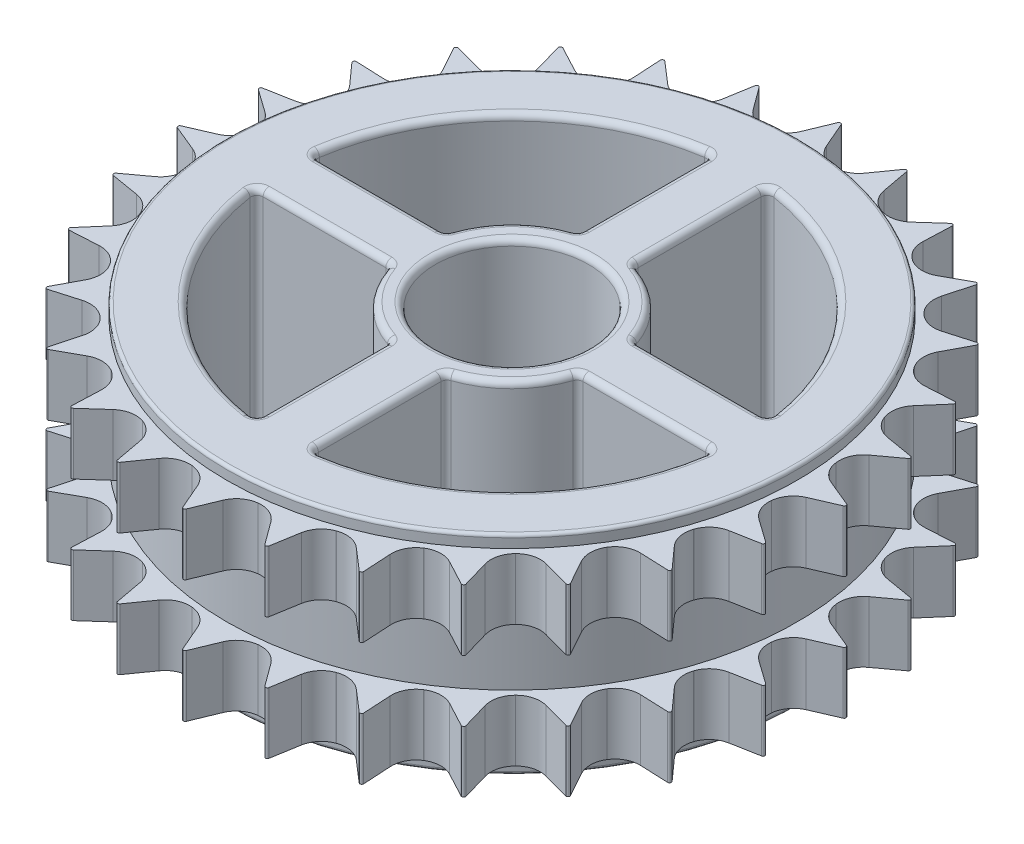
from build123d import *
from build123d.topology import SkipClean

# Parameters (mm, degrees)
BOSS_EXTRUDE2_START  = 2
SKETCH1_R            = 47.5
BOSS_EXTRUDE2_DEPTH  = 10
SKETCH1_7_R          = 46.5
SKETCH1_7_R_2        = 37.5
SKETCH1_7_R_3        = 16
SKETCH1_7_R_4        = 5
SKETCH1_7_R_5        = 2.2
BOSS_EXTRUDE3_DEPTH  = 22
BOSS_EXTRUDE4_START  = 22
SKETCH1_8_R          = 47.5
BOSS_EXTRUDE4_DEPTH  = 10
BOSS_EXTRUDE6_START  = 2
BOSS_EXTRUDE6_DEPTH  = 10
BOSS_EXTRUDE7_START  = 22
BOSS_EXTRUDE7_DEPTH  = 10
FILLET1_R            = 4
FILLET2_R            = 0.3
CIRPATTERN1_START    = 2
CIRPATTERN1_DEPTH    = 10
CIRPATTERN1_START_2  = 22
CIRPATTERN1_2_DEPTH  = 10
SKETCH6_R            = 46.5
SKETCH6_R_2          = 37.5
SKETCH6_R_3          = 16
BOSS_EXTRUDE12_DEPTH = 2
FILLET9_R            = 0.5
CUT_EXTRUDE1_REACH   = 85.63
SKETCH7_R            = 1.5
SKETCH10_R           = 12.5
CUT_EXTRUDE2_DEPTH   = 21
FILLET17_R           = 1


# Read off the part's stored shape, not the designer's step: CirPattern1
with BuildPart() as part:
    # Sketch1 → Boss-Extrude2 (new body)
    with BuildSketch(Plane(origin=(0, 0, 0), x_dir=(1, 0, 0), z_dir=(0, 1, 0)).offset(BOSS_EXTRUDE2_START)):
        with Locations(Location((0, 0, 0), (0, 0, 270))):
            Circle(SKETCH1_R)
        with BuildLine():
            ThreePointArc((-37.229020938, 4.5), (-26.516504294, 26.516504294), (-4.5, 37.229020938))
            Line((-4.5, 37.229020938), (-4.5, 15.354152533))
            ThreePointArc((-4.5, 15.354152533), (-11.313708499, 11.313708499), (-15.354152533, 4.5))
            Line((-15.354152533, 4.5), (-37.229020938, 4.5))
        make_face(mode=Mode.SUBTRACT)
        with BuildLine():
            ThreePointArc((-4.5, -37.229020938), (-26.516504294, -26.516504294), (-37.229020938, -4.5))
            Line((-37.229020938, -4.5), (-15.354152533, -4.5))
            ThreePointArc((-15.354152533, -4.5), (-11.313708499, -11.313708499), (-4.5, -15.354152533))
            Line((-4.5, -15.354152533), (-4.5, -37.229020938))
        make_face(mode=Mode.SUBTRACT)
        with BuildLine():
            ThreePointArc((37.229020938, -4.5), (26.516504294, -26.516504294), (4.5, -37.229020938))
            Line((4.5, -37.229020938), (4.5, -15.354152533))
            ThreePointArc((4.5, -15.354152533), (11.313708499, -11.313708499), (15.354152533, -4.5))
            Line((15.354152533, -4.5), (37.229020938, -4.5))
        make_face(mode=Mode.SUBTRACT)
        with BuildLine():
            ThreePointArc((4.5, 37.229020938), (26.516504294, 26.516504294), (37.229020938, 4.5))
            Line((37.229020938, 4.5), (15.354152533, 4.5))
            ThreePointArc((15.354152533, 4.5), (11.313708499, 11.313708499), (4.5, 15.354152533))
            Line((4.5, 15.354152533), (4.5, 37.229020938))
        make_face(mode=Mode.SUBTRACT)
    extrude(amount=BOSS_EXTRUDE2_DEPTH)

    # Sketch1<7> → Boss-Extrude3 (add)
    # profile 1 of 9: a face of its own
    with SkipClean():  # the faces are left unmerged after this step: merging them gives an invalid solid
        with BuildSketch(Plane(origin=(0, 0, 0), x_dir=(1, 0, 0), z_dir=(0, 1, 0))):
            with Locations(Location((0, 0, 0), (0, 0, 270))):
                Circle(SKETCH1_7_R)
            Circle(SKETCH1_7_R_2, mode=Mode.SUBTRACT)
        # profile 2 of 9: a face of its own
        with BuildSketch(Plane(origin=(0, 0, 0), x_dir=(1, 0, 0), z_dir=(0, 1, 0))):
            Circle(SKETCH1_7_R_3)
            Circle(SKETCH1_7_R_4, mode=Mode.SUBTRACT)
        # profile 3 of 9: a face of its own
        with BuildSketch(Plane(origin=(0, 0, 0), x_dir=(1, 0, 0), z_dir=(0, 1, 0))):
            Circle(SKETCH1_7_R_4)
            Circle(SKETCH1_7_R_5, mode=Mode.SUBTRACT)
        # profile 4 of 9: a face of its own
        with BuildSketch(Plane(origin=(0, 0, 0), x_dir=(1, 0, 0), z_dir=(0, 1, 0))):
            with BuildLine():
                Line((-1.7, -1.396424004), (-1.7, 1.396424004))
                ThreePointArc((-1.7, 1.396424004), (-2.2, 0), (-1.7, -1.396424004))
            make_face()
        # profile 5 of 9: a face of its own
        with BuildSketch(Plane(origin=(0, 0, 0), x_dir=(1, 0, 0), z_dir=(0, 1, 0))):
            with BuildLine():
                ThreePointArc((2.2, 0), (0.741619849, 2.071231518), (-1.7, 1.396424004))
                Line((-1.7, 1.396424004), (-1.7, -1.396424004))
                ThreePointArc((-1.7, -1.396424004), (0.741619849, -2.071231518), (2.2, 0))
            make_face()
        # profile 6 of 9: a face of its own
        with BuildSketch(Plane(origin=(0, 0, 0), x_dir=(1, 0, 0), z_dir=(0, 1, 0))):
            with BuildLine():
                Line((-15.354152533, 4.5), (-37.229020938, 4.5))
                ThreePointArc((-37.229020938, 4.5), (-37.5, 0), (-37.229020938, -4.5))
                Line((-37.229020938, -4.5), (-15.354152533, -4.5))
                ThreePointArc((-15.354152533, -4.5), (-16, 0), (-15.354152533, 4.5))
            make_face()
        # profile 7 of 9: a face of its own
        with BuildSketch(Plane(origin=(0, 0, 0), x_dir=(1, 0, 0), z_dir=(0, 1, 0))):
            with BuildLine():
                Line((-4.5, -15.354152533), (-4.5, -37.229020938))
                ThreePointArc((-4.5, -37.229020938), (0, -37.5), (4.5, -37.229020938))
                Line((4.5, -37.229020938), (4.5, -15.354152533))
                ThreePointArc((4.5, -15.354152533), (0, -16), (-4.5, -15.354152533))
            make_face()
        # profile 8 of 9: a face of its own
        with BuildSketch(Plane(origin=(0, 0, 0), x_dir=(1, 0, 0), z_dir=(0, 1, 0))):
            with BuildLine():
                ThreePointArc((37.5, 0), (37.432193932, 2.254075734), (37.229020938, 4.5))
                Line((37.229020938, 4.5), (15.354152533, 4.5))
                ThreePointArc((15.354152533, 4.5), (15.837715121, 2.273055155), (16, 0))
                ThreePointArc((16, 0), (15.837715121, -2.273055155), (15.354152533, -4.5))
                Line((15.354152533, -4.5), (37.229020938, -4.5))
                ThreePointArc((37.229020938, -4.5), (37.432193932, -2.254075734), (37.5, 0))
            make_face()
        # profile 9 of 9: a face of its own
        with BuildSketch(Plane(origin=(0, 0, 0), x_dir=(1, 0, 0), z_dir=(0, 1, 0))):
            with BuildLine():
                ThreePointArc((4.5, 37.229020938), (0, 37.5), (-4.5, 37.229020938))
                Line((-4.5, 37.229020938), (-4.5, 15.354152533))
                ThreePointArc((-4.5, 15.354152533), (0, 16), (4.5, 15.354152533))
                Line((4.5, 15.354152533), (4.5, 37.229020938))
            make_face()
        extrude(amount=BOSS_EXTRUDE3_DEPTH)
    add(part.part.scale(1), mode=Mode.REPLACE)  # the faces are merged on a copy

    # Sketch1<8> → Boss-Extrude4 (add)
    with BuildSketch(Plane(origin=(0, 0, 0), x_dir=(1, 0, 0), z_dir=(0, 1, 0)).offset(BOSS_EXTRUDE4_START)):
        with Locations(Location((0, 0, 0), (0, 0, 270))):
            Circle(SKETCH1_8_R)
        with BuildLine():
            ThreePointArc((-37.229020938, 4.5), (-26.516504294, 26.516504294), (-4.5, 37.229020938))
            Line((-4.5, 37.229020938), (-4.5, 15.354152533))
            ThreePointArc((-4.5, 15.354152533), (-11.313708499, 11.313708499), (-15.354152533, 4.5))
            Line((-15.354152533, 4.5), (-37.229020938, 4.5))
        make_face(mode=Mode.SUBTRACT)
        with BuildLine():
            ThreePointArc((-4.5, -37.229020938), (-26.516504294, -26.516504294), (-37.229020938, -4.5))
            Line((-37.229020938, -4.5), (-15.354152533, -4.5))
            ThreePointArc((-15.354152533, -4.5), (-11.313708499, -11.313708499), (-4.5, -15.354152533))
            Line((-4.5, -15.354152533), (-4.5, -37.229020938))
        make_face(mode=Mode.SUBTRACT)
        with BuildLine():
            ThreePointArc((37.229020938, -4.5), (26.516504294, -26.516504294), (4.5, -37.229020938))
            Line((4.5, -37.229020938), (4.5, -15.354152533))
            ThreePointArc((4.5, -15.354152533), (11.313708499, -11.313708499), (15.354152533, -4.5))
            Line((15.354152533, -4.5), (37.229020938, -4.5))
        make_face(mode=Mode.SUBTRACT)
        with BuildLine():
            ThreePointArc((4.5, 37.229020938), (26.516504294, 26.516504294), (37.229020938, 4.5))
            Line((37.229020938, 4.5), (15.354152533, 4.5))
            ThreePointArc((15.354152533, 4.5), (11.313708499, 11.313708499), (4.5, 15.354152533))
            Line((4.5, 15.354152533), (4.5, 37.229020938))
        make_face(mode=Mode.SUBTRACT)
        with BuildLine():
            Line((-1.7, -1.396424004), (-1.7, 1.396424004))
            ThreePointArc((-1.7, 1.396424004), (2.2, 0), (-1.7, -1.396424004))
        make_face(mode=Mode.SUBTRACT)
    extrude(amount=BOSS_EXTRUDE4_DEPTH)

    # Sketch1<10> → Boss-Extrude6 (add)
    with BuildSketch(Plane(origin=(0, 0, 0), x_dir=(1, 0, 0), z_dir=(0, 1, 0)).offset(BOSS_EXTRUDE6_START)):
        with BuildLine():
            ThreePointArc((-13.851518822, 45.43550843), (-10.95425386, 46.219631353), (-8.013249598, 46.819203655))
            Line((-8.013249598, 46.819203655), (-12.568564955, 53.030945447))
            Line((-12.568564955, 53.030945447), (-13.851518822, 45.43550843))
        make_face()
    extrude(amount=BOSS_EXTRUDE6_DEPTH)

    # Sketch1<12> → Boss-Extrude7 (add)
    with BuildSketch(Plane(origin=(0, 0, 0), x_dir=(1, 0, 0), z_dir=(0, 1, 0)).offset(BOSS_EXTRUDE7_START)):
        with BuildLine():
            ThreePointArc((-13.851518822, 45.43550843), (-10.95425386, 46.219631353), (-8.013249598, 46.819203655))
            Line((-8.013249598, 46.819203655), (-12.568564955, 53.030945447))
            Line((-12.568564955, 53.030945447), (-13.851518822, 45.43550843))
        make_face()
    extrude(amount=BOSS_EXTRUDE7_DEPTH)

    # Fillet1
    # the kernel refuses this fillet: 4 mm, written as the material it adds along each edge
    with BuildSketch(Plane(origin=(-13.851518822, 2, -45.43550843), x_dir=(-0.9491637939504916, 0, 0.31478261110409), z_dir=(0, 1, 0)), Plane(origin=(-13.851518822, 22, -45.43550843), x_dir=(-0.9491637939504916, 0, 0.31478261110409), z_dir=(0, 1, 0))) as fillet1_piece_1:
        with BuildLine():
            CenterArc((2.407154411, -3.998817417), FILLET1_R, 91.393266483, 60.671643531)
            Line((-1.126761138, -2.124933512), (0, 0))
            ThreePointArc((0, 0), (1.154947824, -0.014043176), (2.309895647, 0))
        make_face()
    extrude(amount=10)
    with BuildSketch(Plane(origin=(-8.013249598, 2, -46.819203655), x_dir=(0.9894779250922444, 0, -0.1446839167120761), z_dir=(0, 1, 0)), Plane(origin=(-8.013249598, 22, -46.819203655), x_dir=(0.9894779250922444, 0, -0.1446839167120761), z_dir=(0, 1, 0))) as fillet1_piece_2:
        with BuildLine():
            CenterArc((2.407154411, 3.998817417), FILLET1_R, 207.935089986, 60.671643531)
            Line((-1.126761138, 2.124933512), (0, 0))
            ThreePointArc((0, 0), (1.154947824, 0.014043176), (2.309895647, 0))
        make_face()
    extrude(amount=10)

    # Fillet2
    fillet2_edges = [part.edges().sort_by_distance(p)[0] for p in [
        (-12.568564955, 7, -53.030945447),
        (-12.568564955, 27, -53.030945447),
    ]]
    fillet(fillet2_edges, radius=FILLET2_R)

    # CirPattern1 outline → CirPattern1 (add)
    with BuildSketch(Plane(origin=(0, 0, 0), x_dir=(1, 0, 0), z_dir=(0, 1, 0)).offset(CIRPATTERN1_START)):
        with BuildLine():
            ThreePointArc((-5.693178393, 47.157583905), (-0.39477231, 47.498359496), (4.908565997, 47.245698003))
            ThreePointArc((4.908565997, 47.245698003), (2.955708963, 47.999217142), (1.650815114, 49.635888682))
            Line((1.650815114, 49.635888682), (-0.171214513, 53.846971164))
            ThreePointArc((-0.171214513, 53.846971164), (-0.449040598, 54.027831221), (-0.723822151, 53.842378285))
            Line((-0.723822151, 53.842378285), (-2.475605911, 49.601592829))
            ThreePointArc((-2.475605911, 49.601592829), (-3.753115694, 47.943458201), (-5.693178393, 47.157583905))
        make_face()
        with BuildLine():
            ThreePointArc((4.943111089, 47.242096193), (10.184504772, 46.395321558), (15.298654844, 44.968891024))
            ThreePointArc((15.298654844, 44.968891024), (13.562433796, 46.138069436), (12.65445004, 48.024072401))
            Line((12.65445004, 48.024072401), (11.815156506, 52.535013987))
            ThreePointArc((11.815156506, 52.535013987), (11.584541251, 52.773161625), (11.275381884, 52.653503029))
            Line((11.275381884, 52.653503029), (8.623855459, 48.908851477))
            ThreePointArc((8.623855459, 48.908851477), (7.009405849, 47.576562416), (4.943111089, 47.242096193))
        make_face()
        with BuildLine():
            ThreePointArc((15.331532341, 44.957692512), (20.253088259, 42.965828468), (24.921605256, 40.437156075))
            ThreePointArc((24.921605256, 40.437156075), (23.489081567, 41.963366272), (23.023538, 44.004128599))
            Line((23.023538, 44.004128599), (23.209066243, 48.588731842))
            ThreePointArc((23.209066243, 48.588731842), (23.037225828, 48.872225344), (22.709191189, 48.82436127))
            Line((22.709191189, 48.82436127), (19.290880707, 45.763616086))
            ThreePointArc((19.290880707, 45.763616086), (17.420446513, 44.823979129), (15.331532341, 44.957692512))
        make_face()
        with BuildLine():
            ThreePointArc((24.951166542, 40.418922402), (29.30609733, 37.381849329), (33.294882316, 33.877733269))
            ThreePointArc((33.294882316, 33.877733269), (32.237888706, 35.6844447), (32.238129627, 37.777634043))
            Line((32.238129627, 37.777634043), (33.439176485, 42.206007794))
            ThreePointArc((33.439176485, 42.206007794), (33.334727707, 42.520631611), (33.004266823, 42.546962164))
            Line((33.004266823, 42.546962164), (28.990580645, 40.323601893))
            ThreePointArc((28.990580645, 40.323601893), (26.957953248, 39.82373436), (24.951166542, 40.418922402))
        make_face()
        with BuildLine():
            ThreePointArc((33.319645066, 33.853378748), (36.88957631, 29.923388171), (39.998614951, 25.619539457))
            ThreePointArc((39.998614951, 25.619539457), (39.370153491, 27.616156065), (39.83616682, 29.656811171))
            Line((39.83616682, 29.656811171), (41.992506788, 33.706898278))
            ThreePointArc((41.992506788, 33.706898278), (41.960687145, 34.036875859), (41.644370705, 34.136080714))
            Line((41.644370705, 34.136080714), (37.236571815, 32.861593924))
            ThreePointArc((37.236571815, 32.861593924), (35.14367564, 32.826561261), (33.319645066, 33.853378748))
        make_face()
        with BuildLine():
            ThreePointArc((40.017337455, 25.590285323), (42.623257896, 20.964443381), (44.696650011, 16.076674958))
            ThreePointArc((44.696650011, 16.076674958), (44.528234385, 18.16307805), (45.436652267, 20.048871951))
            Line((45.436652267, 20.048871951), (48.440157456, 23.517584135))
            ThreePointArc((48.440157456, 23.517584135), (48.482562517, 23.846369026), (48.196251947, 24.013473637))
            Line((48.196251947, 24.013473637), (43.615365788, 23.751768418))
            ThreePointArc((43.615365788, 23.751768418), (41.567147389, 24.183327308), (40.017337455, 25.590285323))
        make_face()
        with BuildLine():
            ThreePointArc((44.708393447, 16.043988138), (46.219631352, 10.95425386), (47.153408404, 5.727658846))
            ThreePointArc((47.153408404, 5.727658846), (47.453483674, 7.799227459), (48.758754243, 9.435598575))
            Line((48.758754243, 9.435598575), (52.45881636, 12.149000122))
            ThreePointArc((52.45881636, 12.149000122), (52.573319759, 12.460105675), (52.331371867, 12.686730721))
            Line((52.331371867, 12.686730721), (47.807103198, 13.450930064))
            ThreePointArc((47.807103198, 13.450930064), (45.906268798, 14.327440343), (44.708393447, 16.043988138))
        make_face()
        with BuildLine():
            ThreePointArc((47.157583905, 5.693178393), (47.498359496, 0.39477231), (47.245698003, -4.908565997))
            ThreePointArc((47.245698003, -4.908565997), (47.999217142, -2.955708963), (49.635888682, -1.650815114))
            Line((49.635888682, -1.650815114), (53.846971164, 0.171214513))
            ThreePointArc((53.846971164, 0.171214513), (54.027831221, 0.449040598), (53.842378285, 0.723822151))
            Line((53.842378285, 0.723822151), (49.601592829, 2.475605911))
            ThreePointArc((49.601592829, 2.475605911), (47.943458201, 3.753115694), (47.157583905, 5.693178393))
        make_face()
        with BuildLine():
            ThreePointArc((47.242096193, -4.943111089), (46.395321558, -10.184504772), (44.968891024, -15.298654844))
            ThreePointArc((44.968891024, -15.298654844), (46.138069436, -13.562433796), (48.024072401, -12.65445004))
            Line((48.024072401, -12.65445004), (52.535013987, -11.815156506))
            ThreePointArc((52.535013987, -11.815156506), (52.773161625, -11.584541251), (52.653503029, -11.275381884))
            Line((52.653503029, -11.275381884), (48.908851477, -8.623855459))
            ThreePointArc((48.908851477, -8.623855459), (47.576562416, -7.009405849), (47.242096193, -4.943111089))
        make_face()
        with BuildLine():
            ThreePointArc((44.957692513, -15.331532341), (42.965828468, -20.253088259), (40.437156075, -24.921605256))
            ThreePointArc((40.437156075, -24.921605256), (41.963366272, -23.489081567), (44.004128599, -23.023538))
            Line((44.004128599, -23.023538), (48.588731842, -23.209066243))
            ThreePointArc((48.588731842, -23.209066243), (48.872225344, -23.037225828), (48.82436127, -22.709191189))
            Line((48.82436127, -22.709191189), (45.763616086, -19.290880707))
            ThreePointArc((45.763616086, -19.290880707), (44.823979129, -17.420446513), (44.957692513, -15.331532341))
        make_face()
        with BuildLine():
            ThreePointArc((40.418922402, -24.951166542), (37.381849329, -29.30609733), (33.87773327, -33.294882317))
            ThreePointArc((33.87773327, -33.294882317), (35.6844447, -32.237888706), (37.777634043, -32.238129627))
            Line((37.777634043, -32.238129627), (42.206007794, -33.439176485))
            ThreePointArc((42.206007794, -33.439176485), (42.520631611, -33.334727707), (42.546962164, -33.004266823))
            Line((42.546962164, -33.004266823), (40.323601893, -28.990580645))
            ThreePointArc((40.323601893, -28.990580645), (39.82373436, -26.957953248), (40.418922402, -24.951166542))
        make_face()
        with BuildLine():
            ThreePointArc((33.853378748, -33.319645066), (29.923388171, -36.88957631), (25.619539457, -39.998614951))
            ThreePointArc((25.619539457, -39.998614951), (27.616156065, -39.370153491), (29.656811171, -39.83616682))
            Line((29.656811171, -39.83616682), (33.706898278, -41.992506788))
            ThreePointArc((33.706898278, -41.992506788), (34.036875859, -41.960687145), (34.136080714, -41.644370705))
            Line((34.136080714, -41.644370705), (32.861593924, -37.236571815))
            ThreePointArc((32.861593924, -37.236571815), (32.826561261, -35.14367564), (33.853378748, -33.319645066))
        make_face()
        with BuildLine():
            ThreePointArc((25.590285324, -40.017337456), (20.964443381, -42.623257897), (16.076674958, -44.696650012))
            ThreePointArc((16.076674958, -44.696650012), (18.16307805, -44.528234385), (20.048871951, -45.436652267))
            Line((20.048871951, -45.436652267), (23.517584135, -48.440157456))
            ThreePointArc((23.517584135, -48.440157456), (23.846369026, -48.482562517), (24.013473637, -48.196251947))
            Line((24.013473637, -48.196251947), (23.751768418, -43.615365788))
            ThreePointArc((23.751768418, -43.615365788), (24.183327308, -41.567147389), (25.590285324, -40.017337456))
        make_face()
        with BuildLine():
            ThreePointArc((16.043988138, -44.708393447), (10.95425386, -46.219631353), (5.727658846, -47.153408405))
            ThreePointArc((5.727658846, -47.153408405), (7.799227459, -47.453483674), (9.435598575, -48.758754243))
            Line((9.435598575, -48.758754243), (12.149000122, -52.45881636))
            ThreePointArc((12.149000122, -52.45881636), (12.460105675, -52.573319759), (12.686730721, -52.331371867))
            Line((12.686730721, -52.331371867), (13.450930064, -47.807103198))
            ThreePointArc((13.450930064, -47.807103198), (14.327440343, -45.906268798), (16.043988138, -44.708393447))
        make_face()
        with BuildLine():
            ThreePointArc((5.693178393, -47.157583906), (0.39477231, -47.498359497), (-4.908565997, -47.245698004))
            ThreePointArc((-4.908565997, -47.245698004), (-2.955708963, -47.999217142), (-1.650815114, -49.635888682))
            Line((-1.650815114, -49.635888682), (0.171214513, -53.846971164))
            ThreePointArc((0.171214513, -53.846971164), (0.449040598, -54.027831221), (0.723822151, -53.842378285))
            Line((0.723822151, -53.842378285), (2.475605911, -49.601592829))
            ThreePointArc((2.475605911, -49.601592829), (3.753115694, -47.943458201), (5.693178393, -47.157583906))
        make_face()
        with BuildLine():
            ThreePointArc((-4.943111089, -47.242096194), (-10.184504772, -46.395321559), (-15.298654844, -44.968891025))
            ThreePointArc((-15.298654844, -44.968891025), (-13.562433796, -46.138069436), (-12.65445004, -48.024072401))
            Line((-12.65445004, -48.024072401), (-11.815156506, -52.535013987))
            ThreePointArc((-11.815156506, -52.535013987), (-11.584541251, -52.773161625), (-11.275381884, -52.653503029))
            Line((-11.275381884, -52.653503029), (-8.623855459, -48.908851477))
            ThreePointArc((-8.623855459, -48.908851477), (-7.009405849, -47.576562416), (-4.943111089, -47.242096194))
        make_face()
        with BuildLine():
            ThreePointArc((-15.331532341, -44.957692513), (-20.253088259, -42.965828469), (-24.921605257, -40.437156076))
            ThreePointArc((-24.921605257, -40.437156076), (-23.489081567, -41.963366272), (-23.023538, -44.004128599))
            Line((-23.023538, -44.004128599), (-23.209066243, -48.588731842))
            ThreePointArc((-23.209066243, -48.588731842), (-23.037225828, -48.872225344), (-22.709191189, -48.82436127))
            Line((-22.709191189, -48.82436127), (-19.290880707, -45.763616086))
            ThreePointArc((-19.290880707, -45.763616086), (-17.420446513, -44.823979129), (-15.331532341, -44.957692513))
        make_face()
        with BuildLine():
            ThreePointArc((-24.951166543, -40.418922403), (-29.306097331, -37.38184933), (-33.294882317, -33.87773327))
            ThreePointArc((-33.294882317, -33.87773327), (-32.237888706, -35.6844447), (-32.238129627, -37.777634043))
            Line((-32.238129627, -37.777634043), (-33.439176485, -42.206007794))
            ThreePointArc((-33.439176485, -42.206007794), (-33.334727707, -42.520631611), (-33.004266823, -42.546962164))
            Line((-33.004266823, -42.546962164), (-28.990580645, -40.323601893))
            ThreePointArc((-28.990580645, -40.323601893), (-26.957953248, -39.82373436), (-24.951166543, -40.418922403))
        make_face()
        with BuildLine():
            ThreePointArc((-33.319645067, -33.853378749), (-36.889576311, -29.923388172), (-39.998614952, -25.619539457))
            ThreePointArc((-39.998614952, -25.619539457), (-39.370153491, -27.616156065), (-39.83616682, -29.656811171))
            Line((-39.83616682, -29.656811171), (-41.992506788, -33.706898278))
            ThreePointArc((-41.992506788, -33.706898278), (-41.960687145, -34.036875859), (-41.644370705, -34.136080714))
            Line((-41.644370705, -34.136080714), (-37.236571815, -32.861593924))
            ThreePointArc((-37.236571815, -32.861593924), (-35.14367564, -32.826561261), (-33.319645067, -33.853378749))
        make_face()
        with BuildLine():
            ThreePointArc((-40.017337456, -25.590285324), (-42.623257897, -20.964443381), (-44.696650013, -16.076674958))
            ThreePointArc((-44.696650013, -16.076674958), (-44.528234385, -18.16307805), (-45.436652267, -20.048871951))
            Line((-45.436652267, -20.048871951), (-48.440157456, -23.517584135))
            ThreePointArc((-48.440157456, -23.517584135), (-48.482562517, -23.846369026), (-48.196251947, -24.013473637))
            Line((-48.196251947, -24.013473637), (-43.615365788, -23.751768418))
            ThreePointArc((-43.615365788, -23.751768418), (-41.567147389, -24.183327308), (-40.017337456, -25.590285324))
        make_face()
        with BuildLine():
            ThreePointArc((-44.708393448, -16.043988138), (-46.219631353, -10.95425386), (-47.153408405, -5.727658846))
            ThreePointArc((-47.153408405, -5.727658846), (-47.453483674, -7.799227459), (-48.758754243, -9.435598575))
            Line((-48.758754243, -9.435598575), (-52.45881636, -12.149000122))
            ThreePointArc((-52.45881636, -12.149000122), (-52.573319759, -12.460105675), (-52.331371867, -12.686730721))
            Line((-52.331371867, -12.686730721), (-47.807103198, -13.450930064))
            ThreePointArc((-47.807103198, -13.450930064), (-45.906268798, -14.327440343), (-44.708393448, -16.043988138))
        make_face()
        with BuildLine():
            ThreePointArc((-47.157583906, -5.693178393), (-47.498359497, -0.39477231), (-47.245698004, 4.908565997))
            ThreePointArc((-47.245698004, 4.908565997), (-47.999217142, 2.955708963), (-49.635888682, 1.650815114))
            Line((-49.635888682, 1.650815114), (-53.846971164, -0.171214513))
            ThreePointArc((-53.846971164, -0.171214513), (-54.027831221, -0.449040598), (-53.842378285, -0.723822151))
            Line((-53.842378285, -0.723822151), (-49.601592829, -2.475605911))
            ThreePointArc((-49.601592829, -2.475605911), (-47.943458201, -3.753115694), (-47.157583906, -5.693178393))
        make_face()
        with BuildLine():
            ThreePointArc((-47.242096194, 4.943111089), (-46.395321559, 10.184504772), (-44.968891025, 15.298654844))
            ThreePointArc((-44.968891025, 15.298654844), (-46.138069436, 13.562433796), (-48.024072401, 12.65445004))
            Line((-48.024072401, 12.65445004), (-52.535013987, 11.815156506))
            ThreePointArc((-52.535013987, 11.815156506), (-52.773161625, 11.584541251), (-52.653503029, 11.275381884))
            Line((-52.653503029, 11.275381884), (-48.908851477, 8.623855459))
            ThreePointArc((-48.908851477, 8.623855459), (-47.576562416, 7.009405849), (-47.242096194, 4.943111089))
        make_face()
        with BuildLine():
            ThreePointArc((-44.957692513, 15.331532341), (-42.965828469, 20.253088259), (-40.437156076, 24.921605256))
            ThreePointArc((-40.437156076, 24.921605256), (-41.963366272, 23.489081567), (-44.004128599, 23.023538))
            Line((-44.004128599, 23.023538), (-48.588731842, 23.209066243))
            ThreePointArc((-48.588731842, 23.209066243), (-48.872225344, 23.037225828), (-48.82436127, 22.709191189))
            Line((-48.82436127, 22.709191189), (-45.763616086, 19.290880707))
            ThreePointArc((-45.763616086, 19.290880707), (-44.823979129, 17.420446513), (-44.957692513, 15.331532341))
        make_face()
        with BuildLine():
            ThreePointArc((-40.418922403, 24.951166542), (-37.381849329, 29.306097331), (-33.87773327, 33.294882317))
            ThreePointArc((-33.87773327, 33.294882317), (-35.6844447, 32.237888706), (-37.777634043, 32.238129627))
            Line((-37.777634043, 32.238129627), (-42.206007794, 33.439176485))
            ThreePointArc((-42.206007794, 33.439176485), (-42.520631611, 33.334727707), (-42.546962164, 33.004266823))
            Line((-42.546962164, 33.004266823), (-40.323601893, 28.990580645))
            ThreePointArc((-40.323601893, 28.990580645), (-39.82373436, 26.957953248), (-40.418922403, 24.951166542))
        make_face()
        with BuildLine():
            ThreePointArc((-33.853378748, 33.319645066), (-29.923388171, 36.88957631), (-25.619539457, 39.998614951))
            ThreePointArc((-25.619539457, 39.998614951), (-27.616156065, 39.370153491), (-29.656811171, 39.83616682))
            Line((-29.656811171, 39.83616682), (-33.706898278, 41.992506788))
            ThreePointArc((-33.706898278, 41.992506788), (-34.036875859, 41.960687145), (-34.136080714, 41.644370705))
            Line((-34.136080714, 41.644370705), (-32.861593924, 37.236571815))
            ThreePointArc((-32.861593924, 37.236571815), (-32.826561261, 35.14367564), (-33.853378748, 33.319645066))
        make_face()
        with BuildLine():
            Line((-20.048871951, 45.436652267), (-23.517584135, 48.440157456))
            ThreePointArc((-23.517584135, 48.440157456), (-23.846369026, 48.482562517), (-24.013473637, 48.196251947))
            Line((-24.013473637, 48.196251947), (-23.751768418, 43.615365788))
            ThreePointArc((-23.751768418, 43.615365788), (-24.183327308, 41.567147389), (-25.590285324, 40.017337456))
            ThreePointArc((-25.590285324, 40.017337456), (-20.964443381, 42.623257896), (-16.076674958, 44.696650012))
            ThreePointArc((-16.076674958, 44.696650012), (-18.16307805, 44.528234385), (-20.048871951, 45.436652267))
        make_face()
    extrude(amount=CIRPATTERN1_DEPTH)

    # CirPattern1 2 outline → CirPattern1 2 (add)
    with BuildSketch(Plane(origin=(0, 0, 0), x_dir=(1, 0, 0), z_dir=(0, 1, 0)).offset(CIRPATTERN1_START_2)):
        with BuildLine():
            ThreePointArc((-5.693178393, 47.157583905), (-0.39477231, 47.498359496), (4.908565997, 47.245698003))
            ThreePointArc((4.908565997, 47.245698003), (2.955708963, 47.999217142), (1.650815114, 49.635888682))
            Line((1.650815114, 49.635888682), (-0.171214513, 53.846971164))
            ThreePointArc((-0.171214513, 53.846971164), (-0.449040598, 54.027831221), (-0.723822151, 53.842378285))
            Line((-0.723822151, 53.842378285), (-2.475605911, 49.601592829))
            ThreePointArc((-2.475605911, 49.601592829), (-3.753115694, 47.943458201), (-5.693178393, 47.157583905))
        make_face()
        with BuildLine():
            ThreePointArc((4.943111089, 47.242096193), (10.184504772, 46.395321558), (15.298654844, 44.968891024))
            ThreePointArc((15.298654844, 44.968891024), (13.562433796, 46.138069436), (12.65445004, 48.024072401))
            Line((12.65445004, 48.024072401), (11.815156506, 52.535013987))
            ThreePointArc((11.815156506, 52.535013987), (11.584541251, 52.773161625), (11.275381884, 52.653503029))
            Line((11.275381884, 52.653503029), (8.623855459, 48.908851477))
            ThreePointArc((8.623855459, 48.908851477), (7.009405849, 47.576562416), (4.943111089, 47.242096193))
        make_face()
        with BuildLine():
            ThreePointArc((15.331532341, 44.957692512), (20.253088259, 42.965828468), (24.921605256, 40.437156075))
            ThreePointArc((24.921605256, 40.437156075), (23.489081567, 41.963366272), (23.023538, 44.004128599))
            Line((23.023538, 44.004128599), (23.209066243, 48.588731842))
            ThreePointArc((23.209066243, 48.588731842), (23.037225828, 48.872225344), (22.709191189, 48.82436127))
            Line((22.709191189, 48.82436127), (19.290880707, 45.763616086))
            ThreePointArc((19.290880707, 45.763616086), (17.420446513, 44.823979129), (15.331532341, 44.957692512))
        make_face()
        with BuildLine():
            ThreePointArc((24.951166542, 40.418922402), (29.30609733, 37.381849329), (33.294882316, 33.877733269))
            ThreePointArc((33.294882316, 33.877733269), (32.237888706, 35.6844447), (32.238129627, 37.777634043))
            Line((32.238129627, 37.777634043), (33.439176485, 42.206007794))
            ThreePointArc((33.439176485, 42.206007794), (33.334727707, 42.520631611), (33.004266823, 42.546962164))
            Line((33.004266823, 42.546962164), (28.990580645, 40.323601893))
            ThreePointArc((28.990580645, 40.323601893), (26.957953248, 39.82373436), (24.951166542, 40.418922402))
        make_face()
        with BuildLine():
            ThreePointArc((33.319645066, 33.853378748), (36.88957631, 29.923388171), (39.998614951, 25.619539457))
            ThreePointArc((39.998614951, 25.619539457), (39.370153491, 27.616156065), (39.83616682, 29.656811171))
            Line((39.83616682, 29.656811171), (41.992506788, 33.706898278))
            ThreePointArc((41.992506788, 33.706898278), (41.960687145, 34.036875859), (41.644370705, 34.136080714))
            Line((41.644370705, 34.136080714), (37.236571815, 32.861593924))
            ThreePointArc((37.236571815, 32.861593924), (35.14367564, 32.826561261), (33.319645066, 33.853378748))
        make_face()
        with BuildLine():
            ThreePointArc((40.017337455, 25.590285323), (42.623257896, 20.964443381), (44.696650011, 16.076674958))
            ThreePointArc((44.696650011, 16.076674958), (44.528234385, 18.16307805), (45.436652267, 20.048871951))
            Line((45.436652267, 20.048871951), (48.440157456, 23.517584135))
            ThreePointArc((48.440157456, 23.517584135), (48.482562517, 23.846369026), (48.196251947, 24.013473637))
            Line((48.196251947, 24.013473637), (43.615365788, 23.751768418))
            ThreePointArc((43.615365788, 23.751768418), (41.567147389, 24.183327308), (40.017337455, 25.590285323))
        make_face()
        with BuildLine():
            ThreePointArc((44.708393447, 16.043988138), (46.219631352, 10.95425386), (47.153408404, 5.727658846))
            ThreePointArc((47.153408404, 5.727658846), (47.453483674, 7.799227459), (48.758754243, 9.435598575))
            Line((48.758754243, 9.435598575), (52.45881636, 12.149000122))
            ThreePointArc((52.45881636, 12.149000122), (52.573319759, 12.460105675), (52.331371867, 12.686730721))
            Line((52.331371867, 12.686730721), (47.807103198, 13.450930064))
            ThreePointArc((47.807103198, 13.450930064), (45.906268798, 14.327440343), (44.708393447, 16.043988138))
        make_face()
        with BuildLine():
            ThreePointArc((47.157583905, 5.693178393), (47.498359496, 0.39477231), (47.245698003, -4.908565997))
            ThreePointArc((47.245698003, -4.908565997), (47.999217142, -2.955708963), (49.635888682, -1.650815114))
            Line((49.635888682, -1.650815114), (53.846971164, 0.171214513))
            ThreePointArc((53.846971164, 0.171214513), (54.027831221, 0.449040598), (53.842378285, 0.723822151))
            Line((53.842378285, 0.723822151), (49.601592829, 2.475605911))
            ThreePointArc((49.601592829, 2.475605911), (47.943458201, 3.753115694), (47.157583905, 5.693178393))
        make_face()
        with BuildLine():
            ThreePointArc((47.242096193, -4.943111089), (46.395321558, -10.184504772), (44.968891024, -15.298654844))
            ThreePointArc((44.968891024, -15.298654844), (46.138069436, -13.562433796), (48.024072401, -12.65445004))
            Line((48.024072401, -12.65445004), (52.535013987, -11.815156506))
            ThreePointArc((52.535013987, -11.815156506), (52.773161625, -11.584541251), (52.653503029, -11.275381884))
            Line((52.653503029, -11.275381884), (48.908851477, -8.623855459))
            ThreePointArc((48.908851477, -8.623855459), (47.576562416, -7.009405849), (47.242096193, -4.943111089))
        make_face()
        with BuildLine():
            ThreePointArc((44.957692513, -15.331532341), (42.965828468, -20.253088259), (40.437156075, -24.921605256))
            ThreePointArc((40.437156075, -24.921605256), (41.963366272, -23.489081567), (44.004128599, -23.023538))
            Line((44.004128599, -23.023538), (48.588731842, -23.209066243))
            ThreePointArc((48.588731842, -23.209066243), (48.872225344, -23.037225828), (48.82436127, -22.709191189))
            Line((48.82436127, -22.709191189), (45.763616086, -19.290880707))
            ThreePointArc((45.763616086, -19.290880707), (44.823979129, -17.420446513), (44.957692513, -15.331532341))
        make_face()
        with BuildLine():
            ThreePointArc((40.418922402, -24.951166542), (37.381849329, -29.30609733), (33.87773327, -33.294882317))
            ThreePointArc((33.87773327, -33.294882317), (35.6844447, -32.237888706), (37.777634043, -32.238129627))
            Line((37.777634043, -32.238129627), (42.206007794, -33.439176485))
            ThreePointArc((42.206007794, -33.439176485), (42.520631611, -33.334727707), (42.546962164, -33.004266823))
            Line((42.546962164, -33.004266823), (40.323601893, -28.990580645))
            ThreePointArc((40.323601893, -28.990580645), (39.82373436, -26.957953248), (40.418922402, -24.951166542))
        make_face()
        with BuildLine():
            ThreePointArc((33.853378748, -33.319645066), (29.923388171, -36.88957631), (25.619539457, -39.998614951))
            ThreePointArc((25.619539457, -39.998614951), (27.616156065, -39.370153491), (29.656811171, -39.83616682))
            Line((29.656811171, -39.83616682), (33.706898278, -41.992506788))
            ThreePointArc((33.706898278, -41.992506788), (34.036875859, -41.960687145), (34.136080714, -41.644370705))
            Line((34.136080714, -41.644370705), (32.861593924, -37.236571815))
            ThreePointArc((32.861593924, -37.236571815), (32.826561261, -35.14367564), (33.853378748, -33.319645066))
        make_face()
        with BuildLine():
            ThreePointArc((25.590285324, -40.017337456), (20.964443381, -42.623257897), (16.076674958, -44.696650012))
            ThreePointArc((16.076674958, -44.696650012), (18.16307805, -44.528234385), (20.048871951, -45.436652267))
            Line((20.048871951, -45.436652267), (23.517584135, -48.440157456))
            ThreePointArc((23.517584135, -48.440157456), (23.846369026, -48.482562517), (24.013473637, -48.196251947))
            Line((24.013473637, -48.196251947), (23.751768418, -43.615365788))
            ThreePointArc((23.751768418, -43.615365788), (24.183327308, -41.567147389), (25.590285324, -40.017337456))
        make_face()
        with BuildLine():
            ThreePointArc((16.043988138, -44.708393447), (10.95425386, -46.219631353), (5.727658846, -47.153408405))
            ThreePointArc((5.727658846, -47.153408405), (7.799227459, -47.453483674), (9.435598575, -48.758754243))
            Line((9.435598575, -48.758754243), (12.149000122, -52.45881636))
            ThreePointArc((12.149000122, -52.45881636), (12.460105675, -52.573319759), (12.686730721, -52.331371867))
            Line((12.686730721, -52.331371867), (13.450930064, -47.807103198))
            ThreePointArc((13.450930064, -47.807103198), (14.327440343, -45.906268798), (16.043988138, -44.708393447))
        make_face()
        with BuildLine():
            ThreePointArc((5.693178393, -47.157583906), (0.39477231, -47.498359497), (-4.908565997, -47.245698004))
            ThreePointArc((-4.908565997, -47.245698004), (-2.955708963, -47.999217142), (-1.650815114, -49.635888682))
            Line((-1.650815114, -49.635888682), (0.171214513, -53.846971164))
            ThreePointArc((0.171214513, -53.846971164), (0.449040598, -54.027831221), (0.723822151, -53.842378285))
            Line((0.723822151, -53.842378285), (2.475605911, -49.601592829))
            ThreePointArc((2.475605911, -49.601592829), (3.753115694, -47.943458201), (5.693178393, -47.157583906))
        make_face()
        with BuildLine():
            ThreePointArc((-4.943111089, -47.242096194), (-10.184504772, -46.395321559), (-15.298654844, -44.968891025))
            ThreePointArc((-15.298654844, -44.968891025), (-13.562433796, -46.138069436), (-12.65445004, -48.024072401))
            Line((-12.65445004, -48.024072401), (-11.815156506, -52.535013987))
            ThreePointArc((-11.815156506, -52.535013987), (-11.584541251, -52.773161625), (-11.275381884, -52.653503029))
            Line((-11.275381884, -52.653503029), (-8.623855459, -48.908851477))
            ThreePointArc((-8.623855459, -48.908851477), (-7.009405849, -47.576562416), (-4.943111089, -47.242096194))
        make_face()
        with BuildLine():
            ThreePointArc((-15.331532341, -44.957692513), (-20.253088259, -42.965828469), (-24.921605257, -40.437156076))
            ThreePointArc((-24.921605257, -40.437156076), (-23.489081567, -41.963366272), (-23.023538, -44.004128599))
            Line((-23.023538, -44.004128599), (-23.209066243, -48.588731842))
            ThreePointArc((-23.209066243, -48.588731842), (-23.037225828, -48.872225344), (-22.709191189, -48.82436127))
            Line((-22.709191189, -48.82436127), (-19.290880707, -45.763616086))
            ThreePointArc((-19.290880707, -45.763616086), (-17.420446513, -44.823979129), (-15.331532341, -44.957692513))
        make_face()
        with BuildLine():
            ThreePointArc((-24.951166543, -40.418922403), (-29.306097331, -37.38184933), (-33.294882317, -33.87773327))
            ThreePointArc((-33.294882317, -33.87773327), (-32.237888706, -35.6844447), (-32.238129627, -37.777634043))
            Line((-32.238129627, -37.777634043), (-33.439176485, -42.206007794))
            ThreePointArc((-33.439176485, -42.206007794), (-33.334727707, -42.520631611), (-33.004266823, -42.546962164))
            Line((-33.004266823, -42.546962164), (-28.990580645, -40.323601893))
            ThreePointArc((-28.990580645, -40.323601893), (-26.957953248, -39.82373436), (-24.951166543, -40.418922403))
        make_face()
        with BuildLine():
            ThreePointArc((-33.319645067, -33.853378749), (-36.889576311, -29.923388172), (-39.998614952, -25.619539457))
            ThreePointArc((-39.998614952, -25.619539457), (-39.370153491, -27.616156065), (-39.83616682, -29.656811171))
            Line((-39.83616682, -29.656811171), (-41.992506788, -33.706898278))
            ThreePointArc((-41.992506788, -33.706898278), (-41.960687145, -34.036875859), (-41.644370705, -34.136080714))
            Line((-41.644370705, -34.136080714), (-37.236571815, -32.861593924))
            ThreePointArc((-37.236571815, -32.861593924), (-35.14367564, -32.826561261), (-33.319645067, -33.853378749))
        make_face()
        with BuildLine():
            ThreePointArc((-40.017337456, -25.590285324), (-42.623257897, -20.964443381), (-44.696650013, -16.076674958))
            ThreePointArc((-44.696650013, -16.076674958), (-44.528234385, -18.16307805), (-45.436652267, -20.048871951))
            Line((-45.436652267, -20.048871951), (-48.440157456, -23.517584135))
            ThreePointArc((-48.440157456, -23.517584135), (-48.482562517, -23.846369026), (-48.196251947, -24.013473637))
            Line((-48.196251947, -24.013473637), (-43.615365788, -23.751768418))
            ThreePointArc((-43.615365788, -23.751768418), (-41.567147389, -24.183327308), (-40.017337456, -25.590285324))
        make_face()
        with BuildLine():
            ThreePointArc((-44.708393448, -16.043988138), (-46.219631353, -10.95425386), (-47.153408405, -5.727658846))
            ThreePointArc((-47.153408405, -5.727658846), (-47.453483674, -7.799227459), (-48.758754243, -9.435598575))
            Line((-48.758754243, -9.435598575), (-52.45881636, -12.149000122))
            ThreePointArc((-52.45881636, -12.149000122), (-52.573319759, -12.460105675), (-52.331371867, -12.686730721))
            Line((-52.331371867, -12.686730721), (-47.807103198, -13.450930064))
            ThreePointArc((-47.807103198, -13.450930064), (-45.906268798, -14.327440343), (-44.708393448, -16.043988138))
        make_face()
        with BuildLine():
            ThreePointArc((-47.157583906, -5.693178393), (-47.498359497, -0.39477231), (-47.245698004, 4.908565997))
            ThreePointArc((-47.245698004, 4.908565997), (-47.999217142, 2.955708963), (-49.635888682, 1.650815114))
            Line((-49.635888682, 1.650815114), (-53.846971164, -0.171214513))
            ThreePointArc((-53.846971164, -0.171214513), (-54.027831221, -0.449040598), (-53.842378285, -0.723822151))
            Line((-53.842378285, -0.723822151), (-49.601592829, -2.475605911))
            ThreePointArc((-49.601592829, -2.475605911), (-47.943458201, -3.753115694), (-47.157583906, -5.693178393))
        make_face()
        with BuildLine():
            ThreePointArc((-47.242096194, 4.943111089), (-46.395321559, 10.184504772), (-44.968891025, 15.298654844))
            ThreePointArc((-44.968891025, 15.298654844), (-46.138069436, 13.562433796), (-48.024072401, 12.65445004))
            Line((-48.024072401, 12.65445004), (-52.535013987, 11.815156506))
            ThreePointArc((-52.535013987, 11.815156506), (-52.773161625, 11.584541251), (-52.653503029, 11.275381884))
            Line((-52.653503029, 11.275381884), (-48.908851477, 8.623855459))
            ThreePointArc((-48.908851477, 8.623855459), (-47.576562416, 7.009405849), (-47.242096194, 4.943111089))
        make_face()
        with BuildLine():
            ThreePointArc((-44.957692513, 15.331532341), (-42.965828469, 20.253088259), (-40.437156076, 24.921605256))
            ThreePointArc((-40.437156076, 24.921605256), (-41.963366272, 23.489081567), (-44.004128599, 23.023538))
            Line((-44.004128599, 23.023538), (-48.588731842, 23.209066243))
            ThreePointArc((-48.588731842, 23.209066243), (-48.872225344, 23.037225828), (-48.82436127, 22.709191189))
            Line((-48.82436127, 22.709191189), (-45.763616086, 19.290880707))
            ThreePointArc((-45.763616086, 19.290880707), (-44.823979129, 17.420446513), (-44.957692513, 15.331532341))
        make_face()
        with BuildLine():
            ThreePointArc((-40.418922403, 24.951166542), (-37.381849329, 29.306097331), (-33.87773327, 33.294882317))
            ThreePointArc((-33.87773327, 33.294882317), (-35.6844447, 32.237888706), (-37.777634043, 32.238129627))
            Line((-37.777634043, 32.238129627), (-42.206007794, 33.439176485))
            ThreePointArc((-42.206007794, 33.439176485), (-42.520631611, 33.334727707), (-42.546962164, 33.004266823))
            Line((-42.546962164, 33.004266823), (-40.323601893, 28.990580645))
            ThreePointArc((-40.323601893, 28.990580645), (-39.82373436, 26.957953248), (-40.418922403, 24.951166542))
        make_face()
        with BuildLine():
            ThreePointArc((-33.853378748, 33.319645066), (-29.923388171, 36.88957631), (-25.619539457, 39.998614951))
            ThreePointArc((-25.619539457, 39.998614951), (-27.616156065, 39.370153491), (-29.656811171, 39.83616682))
            Line((-29.656811171, 39.83616682), (-33.706898278, 41.992506788))
            ThreePointArc((-33.706898278, 41.992506788), (-34.036875859, 41.960687145), (-34.136080714, 41.644370705))
            Line((-34.136080714, 41.644370705), (-32.861593924, 37.236571815))
            ThreePointArc((-32.861593924, 37.236571815), (-32.826561261, 35.14367564), (-33.853378748, 33.319645066))
        make_face()
        with BuildLine():
            Line((-20.048871951, 45.436652267), (-23.517584135, 48.440157456))
            ThreePointArc((-23.517584135, 48.440157456), (-23.846369026, 48.482562517), (-24.013473637, 48.196251947))
            Line((-24.013473637, 48.196251947), (-23.751768418, 43.615365788))
            ThreePointArc((-23.751768418, 43.615365788), (-24.183327308, 41.567147389), (-25.590285324, 40.017337456))
            ThreePointArc((-25.590285324, 40.017337456), (-20.964443381, 42.623257896), (-16.076674958, 44.696650012))
            ThreePointArc((-16.076674958, 44.696650012), (-18.16307805, 44.528234385), (-20.048871951, 45.436652267))
        make_face()
    extrude(amount=CIRPATTERN1_2_DEPTH)

    # Sketch6 → Boss-Extrude12 (add)
    # profile 1 of 6: a face of its own
    with BuildSketch(Plane(origin=(0, 32, 0), x_dir=(1, 0, 0), z_dir=(0, 1, 0))):
        with Locations(Location((0, 0, 0), (0, 0, 270))):
            Circle(SKETCH6_R)
        Circle(SKETCH6_R_2, mode=Mode.SUBTRACT)
    # profile 2 of 6: a face of its own
    with BuildSketch(Plane(origin=(0, 32, 0), x_dir=(1, 0, 0), z_dir=(0, 1, 0))):
        with BuildLine():
            Line((-4.5, 37.229020938), (-4.5, 15.354152533))
            ThreePointArc((-4.5, 15.354152533), (0, 16), (4.5, 15.354152533))
            Line((4.5, 15.354152533), (4.5, 37.229020938))
            ThreePointArc((4.5, 37.229020938), (0, 37.5), (-4.5, 37.229020938))
        make_face()
    # profile 3 of 6: a face of its own
    with BuildSketch(Plane(origin=(0, 32, 0), x_dir=(1, 0, 0), z_dir=(0, 1, 0))):
        with BuildLine():
            ThreePointArc((-15.354152533, -4.5), (-16, 0), (-15.354152533, 4.5))
            Line((-15.354152533, 4.5), (-37.229020938, 4.5))
            ThreePointArc((-37.229020938, 4.5), (-37.5, 0), (-37.229020938, -4.5))
            Line((-37.229020938, -4.5), (-15.354152533, -4.5))
        make_face()
    # profile 4 of 6: a face of its own
    with BuildSketch(Plane(origin=(0, 32, 0), x_dir=(1, 0, 0), z_dir=(0, 1, 0))):
        with BuildLine():
            ThreePointArc((4.5, -15.354152533), (0, -16), (-4.5, -15.354152533))
            Line((-4.5, -15.354152533), (-4.5, -37.229020938))
            ThreePointArc((-4.5, -37.229020938), (0, -37.5), (4.5, -37.229020938))
            Line((4.5, -37.229020938), (4.5, -15.354152533))
        make_face()
    # profile 5 of 6: a face of its own
    with BuildSketch(Plane(origin=(0, 32, 0), x_dir=(1, 0, 0), z_dir=(0, 1, 0))):
        Circle(SKETCH6_R_3)
    # profile 6 of 6: a face of its own
    with BuildSketch(Plane(origin=(0, 32, 0), x_dir=(1, 0, 0), z_dir=(0, 1, 0))):
        with BuildLine():
            Line((37.229020938, 4.5), (15.354152533, 4.5))
            ThreePointArc((15.354152533, 4.5), (15.837715121, 2.273055155), (16, 0))
            ThreePointArc((16, 0), (15.837715121, -2.273055155), (15.354152533, -4.5))
            Line((15.354152533, -4.5), (37.229020938, -4.5))
            ThreePointArc((37.229020938, -4.5), (37.432193932, -2.254075734), (37.5, 0))
            ThreePointArc((37.5, 0), (37.432193932, 2.254075734), (37.229020938, 4.5))
        make_face()
    extrude(amount=BOSS_EXTRUDE12_DEPTH)

    # Fillet9
    fillet9_edges = [part.edges().sort_by_distance(p)[0] for p in [
        (0, 34, -46.5),
        (0, 0, -46.5),
    ]]
    fillet(fillet9_edges, radius=FILLET9_R)

    # Sketch7 → Cut-Extrude1 (cut, up to next)
    with BuildSketch(Plane(origin=(0, 34, 0), x_dir=(1, 0, 0), z_dir=(0, 1, 0)), mode=Mode.PRIVATE) as cut_extrude1_sk1:
        with Locations(Location((-8, 0, 0), (0, 0, 270))):
            Circle(SKETCH7_R)
    cut_extrude1_tool1 = extrude(cut_extrude1_sk1.sketch, amount=-CUT_EXTRUDE1_REACH, mode=Mode.PRIVATE) & part.part
    # Sketch7 → Cut-Extrude1 (cut, up to next)
    with BuildSketch(Plane(origin=(0, 34, 0), x_dir=(1, 0, 0), z_dir=(0, 1, 0)), mode=Mode.PRIVATE) as cut_extrude1_sk2:
        with Locations(Location((0, 8, 0), (0, 0, 270))):
            Circle(SKETCH7_R)
    cut_extrude1_tool2 = extrude(cut_extrude1_sk2.sketch, amount=-CUT_EXTRUDE1_REACH, mode=Mode.PRIVATE) & part.part
    # Sketch7 → Cut-Extrude1 (cut, up to next)
    with BuildSketch(Plane(origin=(0, 34, 0), x_dir=(1, 0, 0), z_dir=(0, 1, 0)), mode=Mode.PRIVATE) as cut_extrude1_sk3:
        with Locations(Location((8, 0, 0), (0, 0, 270))):
            Circle(SKETCH7_R)
    cut_extrude1_tool3 = extrude(cut_extrude1_sk3.sketch, amount=-CUT_EXTRUDE1_REACH, mode=Mode.PRIVATE) & part.part
    # Sketch7 → Cut-Extrude1 (cut, up to next)
    with BuildSketch(Plane(origin=(0, 34, 0), x_dir=(1, 0, 0), z_dir=(0, 1, 0)), mode=Mode.PRIVATE) as cut_extrude1_sk4:
        with Locations(Location((0, -8, 0), (0, 0, 270))):
            Circle(SKETCH7_R)
    cut_extrude1_tool4 = extrude(cut_extrude1_sk4.sketch, amount=-CUT_EXTRUDE1_REACH, mode=Mode.PRIVATE) & part.part
    add(cut_extrude1_tool1.solids().sort_by_distance((-8, 34, 0))[0], mode=Mode.SUBTRACT)
    add(cut_extrude1_tool2.solids().sort_by_distance((0, 34, -8))[0], mode=Mode.SUBTRACT)
    add(cut_extrude1_tool3.solids().sort_by_distance((8, 34, 0))[0], mode=Mode.SUBTRACT)
    add(cut_extrude1_tool4.solids().sort_by_distance((0, 34, 8))[0], mode=Mode.SUBTRACT)

    # Sketch10 → Cut-Extrude2 (cut)
    with BuildSketch(Plane(origin=(0, 34, 0), x_dir=(1, 0, 0), z_dir=(0, 1, 0))):
        with Locations(Location((0, 0, 0), (0, 0, 270))):
            Circle(SKETCH10_R)
    extrude(amount=-CUT_EXTRUDE2_DEPTH, mode=Mode.SUBTRACT)

    # Fillet17
    fillet17_edges = [part.edges().sort_by_distance(p)[0] for p in [
        (4.5, 17, 15.354152533),
        (4.5, 17, 37.229020938),
        (37.229020938, 17, 4.5),
        (15.354152533, 17, 4.5),
        (4.5, 17, -37.229020938),
        (4.5, 17, -15.354152533),
        (15.354152533, 17, -4.5),
        (37.229020938, 17, -4.5),
        (-37.229020938, 17, -4.5),
        (-15.354152533, 17, -4.5),
        (-4.5, 17, -15.354152533),
        (-4.5, 17, -37.229020938),
        (-4.5, 17, 37.229020938),
        (-4.5, 17, 15.354152533),
        (-15.354152533, 17, 4.5),
        (-37.229020938, 17, 4.5),
        (-26.516504294, 34, -26.516504294),
        (-4.5, 34, -26.291586735),
        (26.516504294, 34, -26.516504294),
        (26.291586735, 34, -4.5),
        (26.516504294, 34, 26.516504294),
        (4.5, 34, 26.291586735),
        (-26.516504294, 34, 26.516504294),
        (-26.291586735, 34, 4.5),
        (-11.313708499, 34, 11.313708499),
        (-4.5, 34, 26.291586735),
        (11.313708499, 34, 11.313708499),
        (26.291586735, 34, 4.5),
        (11.313708499, 34, -11.313708499),
        (4.5, 34, -26.291586735),
        (-26.291586735, 34, -4.5),
        (-11.313708499, 34, -11.313708499),
        (0, 34, -12.5),
        (-11.313708499, 0, 11.313708499),
        (-26.291586735, 0, 4.5),
        (-11.313708499, 0, -11.313708499),
        (-4.5, 0, -26.291586735),
        (11.313708499, 0, -11.313708499),
        (26.291586735, 0, -4.5),
        (4.5, 0, 26.291586735),
        (11.313708499, 0, 11.313708499),
        (26.516504294, 0, 26.516504294),
        (26.291586735, 0, 4.5),
        (26.516504294, 0, -26.516504294),
        (4.5, 0, -26.291586735),
        (-26.516504294, 0, -26.516504294),
        (-26.291586735, 0, -4.5),
        (-26.516504294, 0, 26.516504294),
        (-4.5, 0, 26.291586735),
    ]]
    fillet(fillet17_edges, radius=FILLET17_R)


solid = part.part
